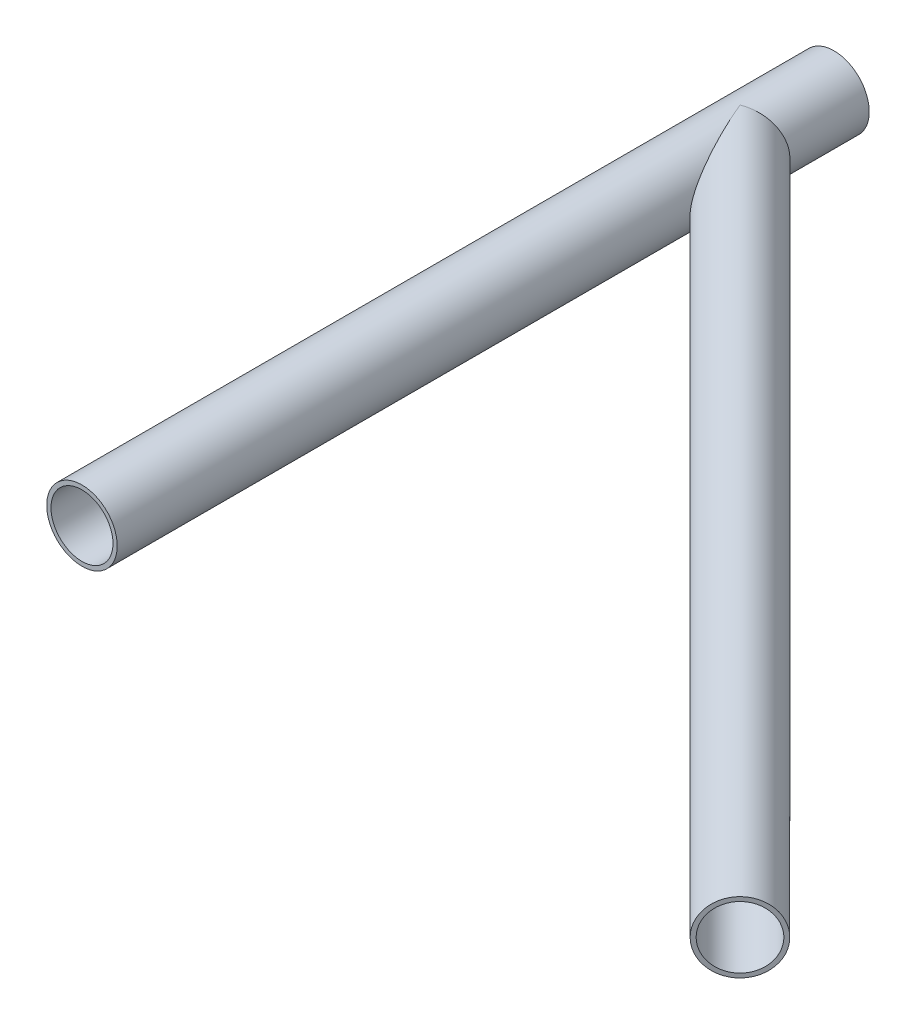
from build123d import *

# Parameters (mm, degrees)
SKETCH1_R             = 9.525
SKETCH1_R_2           = 8.382
BOSS_EXTRUDE2_DEPTH   = 203.2
SWEEP_THIN1_START     = 17.960512242
SWEEP_THIN1_OUTLINE_R = 8.382
SWEEP_THIN1_DEPTH     = 261.968195874


# Read off the part's stored shape, not the designer's step: Sweep-Thin1
with BuildPart() as part:
    # Sketch1 → Boss-Extrude2 (new body)
    with BuildSketch(Plane.XY):
        with Locations(Location((0, 0, 0), (0, 0, 180))):
            Circle(SKETCH1_R)
        with Locations(Location((0, 0, 0), (0, 0, 180))):
            Circle(SKETCH1_R_2, mode=Mode.SUBTRACT)
    extrude(amount=BOSS_EXTRUDE2_DEPTH)

    # Sweep-Thin1 outline → Sweep-Thin1 (add)
    with BuildSketch(Plane(origin=(0, 0, 0), x_dir=(0.7071067811865474, 0, -0.7071067811865477), z_dir=(0.7071067811865476, 0, 0.7071067811865476)).offset(SWEEP_THIN1_START)):
        with BuildLine():
            ThreePointArc((-22.484132156, 8.382272238), (-27.48551224, 0.000176979), (-22.484443646, -8.382104131))
            ThreePointArc((-22.484443646, -8.382104131), (-16.812644927, -9.455581718), (-11.562434249, -7.056218747))
            ThreePointArc((-11.562434249, -7.056218747), (-8.435512242, 0), (-11.562434249, 7.056218747))
            ThreePointArc((-11.562434249, 7.056218747), (-16.812469239, 9.455560389), (-22.484132156, 8.382272238))
        make_face()
        with Locations((-17.960512242, 0)):
            Circle(SWEEP_THIN1_OUTLINE_R, mode=Mode.SUBTRACT)
    extrude(amount=SWEEP_THIN1_DEPTH)


solid = part.part
